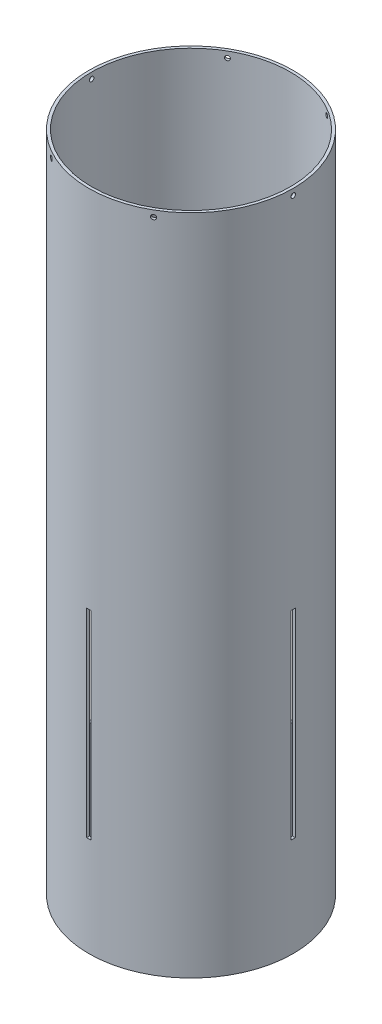
from build123d import *

# Parameters (mm, degrees)
SKETCH1_R           = 78.359
SKETCH1_R_2         = 76.2
BOSS_EXTRUDE1_DEPTH = 508
CUT_EXTRUDE1_DEPTH  = 520.946406625
CIRPATTERN1_COUNT   = 4
CUT_EXTRUDE2_DEPTH  = 520.946406625
CIRPATTERN2_COUNT   = 6
SKETCH3_R           = 3.175
CUT_EXTRUDE3_DEPTH  = 520.946406753


with BuildPart() as part:
    # Sketch1 → Boss-Extrude1 (new body)
    with BuildSketch(Plane(origin=(0, 0, 0), x_dir=(1, 0, 0), z_dir=(0, 1, 0))):
        Circle(SKETCH1_R)
        Circle(SKETCH1_R_2, mode=Mode.SUBTRACT)
    extrude(amount=BOSS_EXTRUDE1_DEPTH)

    # Sketch2 → Cut-Extrude1 (cut, through all)
    with BuildSketch(Plane(origin=(0, 0, 0), x_dir=(0, 0, -1), z_dir=(1, 0, 0))):
        Polygon((0, 76.2), (1.5875, 76.2), (1.5875, 228.6), (-1.5875, 228.6), (-1.5875, 76.2), align=None)
    cut_extrude1 = extrude(amount=-CUT_EXTRUDE1_DEPTH, mode=Mode.SUBTRACT)

    # CirPattern1: Cut-Extrude1 ×4 about axis
    cirpattern1_axis = Axis((0, 0, 0), (0, 1, 0))
    for i in range(1, CIRPATTERN1_COUNT):
        add(cut_extrude1.rotate(cirpattern1_axis, i * 360 / CIRPATTERN1_COUNT), mode=Mode.SUBTRACT)

    # Sketch2<3> → Cut-Extrude2 (cut, through all)
    with BuildSketch(Plane(origin=(0, 0, 0), x_dir=(0, 0, -1), z_dir=(1, 0, 0))):
        with BuildLine():
            ThreePointArc((0, 504.987500056), (-1.237436907, 502.000063093), (1.750000056, 503.2375))
            ThreePointArc((1.750000056, 503.2375), (1.237436907, 504.474936907), (0, 504.987500056))
        make_face()
    cut_extrude2 = extrude(amount=-CUT_EXTRUDE2_DEPTH, mode=Mode.SUBTRACT)

    # CirPattern2: Cut-Extrude2 ×6 about axis
    cirpattern2_axis = Axis((0, 508, 0), (0, -1, 0))
    for i in range(1, CIRPATTERN2_COUNT):
        add(cut_extrude2.rotate(cirpattern2_axis, i * 360 / CIRPATTERN2_COUNT), mode=Mode.SUBTRACT)

    # Sketch3 → Cut-Extrude3 (cut, through all)
    with BuildSketch(Plane(origin=(0, 0, 0), x_dir=(0.7071067811865477, 0, -0.7071067811865475), z_dir=(0.7071067811865475, 0, 0.7071067811865477))):
        with Locations((0, 127)):
            Circle(SKETCH3_R)
    extrude(amount=-CUT_EXTRUDE3_DEPTH, mode=Mode.SUBTRACT)


solid = part.part
